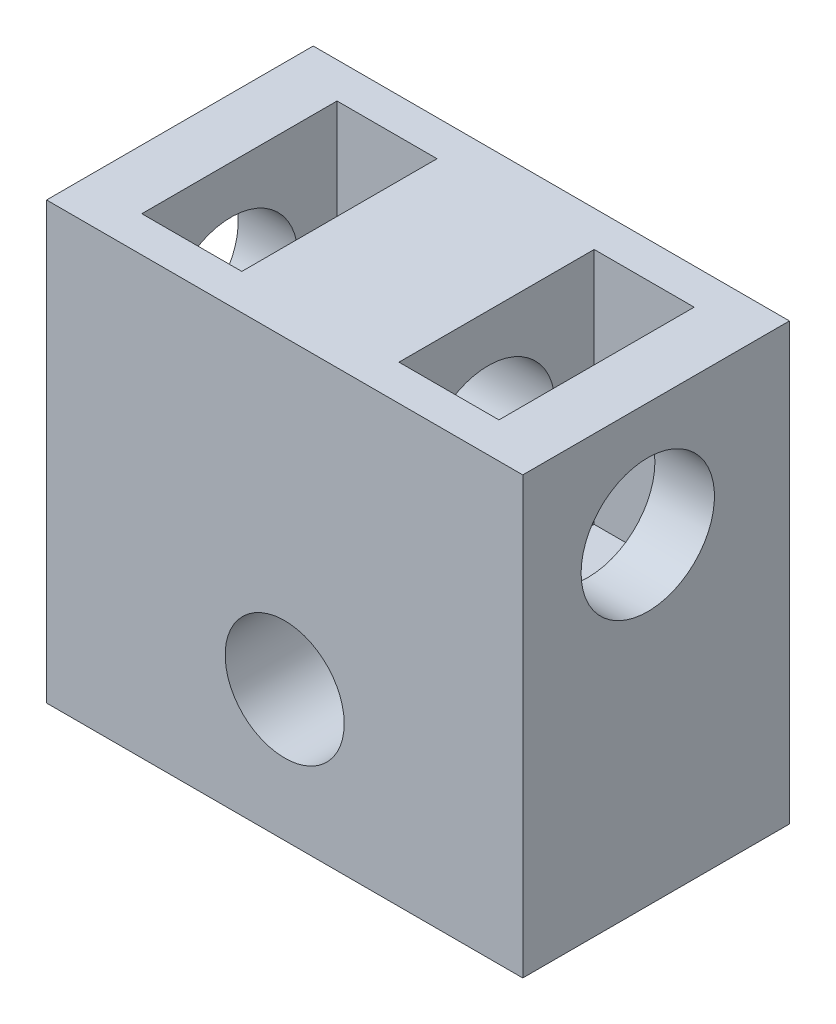
from build123d import *

# Parameters (mm, degrees)
SKETCH6_W           = 20
SKETCH6_H           = 11.2
BOSS_EXTRUDE2_DEPTH = 18.3
SKETCH7_R           = 2.5
CUT_EXTRUDE4_DEPTH  = 30.331382511
SKETCH8_R           = 2.8
CUT_EXTRUDE5_DEPTH  = 30.331382511
SKETCH9_W           = 4.2
SKETCH9_H           = 8.2
CUT_EXTRUDE6_DEPTH  = 10


with BuildPart() as part:
    # Sketch6 → Boss-Extrude2 (new body)
    with BuildSketch(Plane(origin=(0, 0, 0), x_dir=(1, 0, 0), z_dir=(0, 1, 0))):
        with Locations((10, 5.6)):
            Rectangle(SKETCH6_W, SKETCH6_H)
    extrude(amount=BOSS_EXTRUDE2_DEPTH)

    # Sketch7 → Cut-Extrude4 (cut, through all)
    with BuildSketch(Plane.XY):
        with Locations((10, 5.5)):
            Circle(SKETCH7_R)
    extrude(amount=-CUT_EXTRUDE4_DEPTH, mode=Mode.SUBTRACT)

    # Sketch8 → Cut-Extrude5 (cut, through all)
    with BuildSketch(Plane.ZY):
        with Locations((-5.25, 13.5)):
            Circle(SKETCH8_R)
    extrude(amount=-CUT_EXTRUDE5_DEPTH, mode=Mode.SUBTRACT)

    # Sketch9 → Cut-Extrude6 (cut)
    with BuildSketch(Plane(origin=(0, 18.3, 0), x_dir=(1, 0, 0), z_dir=(0, 1, 0))):
        with Locations((4.6, 5.6)):
            Rectangle(SKETCH9_W, SKETCH9_H)
        with Locations((15.4, 5.6)):
            Rectangle(SKETCH9_W, SKETCH9_H)
    extrude(amount=-CUT_EXTRUDE6_DEPTH, mode=Mode.SUBTRACT)


solid = part.part
